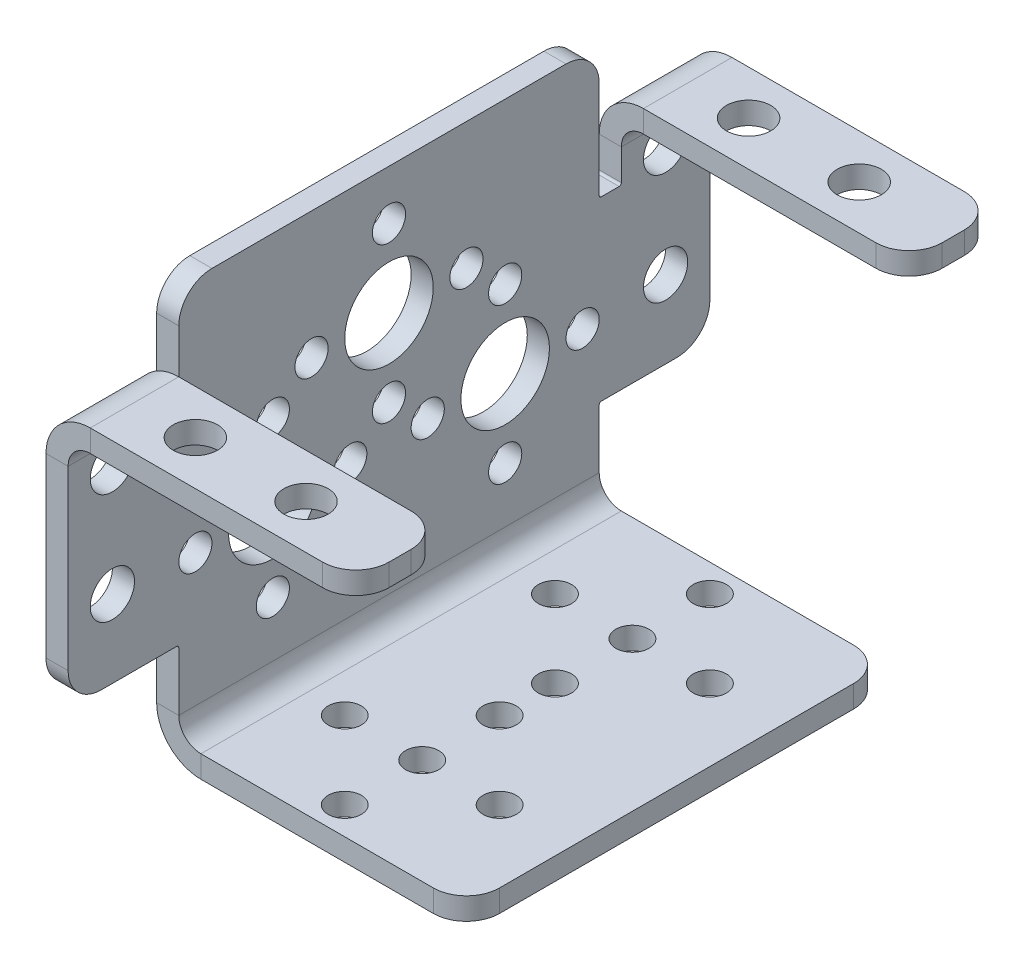
from build123d import *

# Parameters (mm, degrees)
BOSS_EXTRUDE1_DEPTH            = 1
CONVERT_SOLID1_START           = -1
CONVERT_SOLID1_DEPTH           = 1
EDGE_FLANGE1_STRIP_W           = 12
EDGE_FLANGE1_STRIP_H           = 2
EDGE_FLANGE1_STRIP_CUT_DEPTH   = 38
EDGE_FLANGE1_DEPTH             = 38
EDGE_FLANGE2_STRIP_W           = 12
EDGE_FLANGE2_STRIP_H           = 2
EDGE_FLANGE2_STRIP_CUT_DEPTH   = 8
EDGE_FLANGE2_STRIP_2_W         = 12
EDGE_FLANGE2_STRIP_2_H         = 2
EDGE_FLANGE2_STRIP_CUT_2_DEPTH = 8
EDGE_FLANGE2_DEPTH             = 8
EDGE_FLANGE2_BEND_DEPTH        = 8
FILLET1_R                      = 3
M3X0_5_TAPPED_HOLE1_D          = 3
SKETCH20_R                     = 4
CUT_EXTRUDE1_DEPTH             = 44.667665669
M4X0_7_TAPPED_HOLE1_D          = 4
M4X0_7_TAPPED_HOLE2_D          = 4
M3X0_5_TAPPED_HOLE2_D          = 3
FILLET2_R                      = 0.2


# Read off the part's stored shape, not the designer's step: Convert-Solid1
# Sheet-metal steps are written as plain solids
with BuildPart() as part:
    # Sketch1 → Boss-Extrude1 (new body)
    with BuildSketch(Plane(origin=(0, 0, 0), x_dir=(0, 0, -1), z_dir=(1, 0, 0))):
        with BuildLine():
            Line((-19, -17.745), (19, -17.745))
            Line((19, -17.745), (19, -10.245))
            Line((19, -10.245), (26, -10.245))
            ThreePointArc((26, -10.245), (28.121320344, -9.366320344), (29, -7.245))
            Line((29, -7.245), (29, 10.755))
            Line((29, 10.755), (21, 10.755))
            Line((21, 10.755), (21, 5.755))
            Line((21, 5.755), (19, 5.755))
            Line((19, 5.755), (19, 14.745))
            ThreePointArc((19, 14.745), (18.121320344, 16.866320344), (16, 17.745))
            Line((16, 17.745), (-16, 17.745))
            ThreePointArc((-16, 17.745), (-18.121320344, 16.866320344), (-19, 14.745))
            Line((-19, 14.745), (-19, 5.755))
            Line((-19, 5.755), (-21, 5.755))
            Line((-21, 5.755), (-21, 10.755))
            Line((-21, 10.755), (-29, 10.755))
            Line((-29, 10.755), (-29, -7.245))
            ThreePointArc((-29, -7.245), (-28.121320344, -9.366320344), (-26, -10.245))
            Line((-26, -10.245), (-19, -10.245))
            Line((-19, -10.245), (-19, -17.745))
        make_face()
    extrude(amount=BOSS_EXTRUDE1_DEPTH)

    # Convert-Solid1 outline → Convert-Solid1 (add)
    with BuildSketch(Plane.YZ.offset(CONVERT_SOLID1_START)):
        with BuildLine():
            Line((17.745, -16), (17.745, 16))
            ThreePointArc((17.745, 16), (16.866320344, 18.121320344), (14.745, 19))
            Line((14.745, 19), (5.755, 19))
            Line((5.755, 19), (5.755, 21))
            Line((5.755, 21), (10.755, 21))
            Line((10.755, 21), (10.755, 29))
            Line((10.755, 29), (-7.245, 29))
            ThreePointArc((-7.245, 29), (-9.366320344, 28.121320344), (-10.245, 26))
            Line((-10.245, 26), (-10.245, 19))
            Line((-10.245, 19), (-17.745, 19))
            Line((-17.745, 19), (-17.745, -19))
            Line((-17.745, -19), (-10.245, -19))
            Line((-10.245, -19), (-10.245, -26))
            ThreePointArc((-10.245, -26), (-9.366320344, -28.121320344), (-7.245, -29))
            Line((-7.245, -29), (10.755, -29))
            Line((10.755, -29), (10.755, -21))
            Line((10.755, -21), (5.755, -21))
            Line((5.755, -21), (5.755, -19))
            Line((5.755, -19), (14.745, -19))
            ThreePointArc((14.745, -19), (16.866320344, -18.121320344), (17.745, -16))
        make_face()
    extrude(amount=CONVERT_SOLID1_DEPTH)

    # Edge-Flange1 strip (across the edge) → Edge-Flange1 strip cut (cut)
    with BuildSketch(Plane(origin=(1, -17.745, 19), x_dir=(0, 1, 0), z_dir=(0, 0, -1))):
        with Locations((-4, -1)):
            Rectangle(EDGE_FLANGE1_STRIP_W, EDGE_FLANGE1_STRIP_H)
    extrude(amount=EDGE_FLANGE1_STRIP_CUT_DEPTH, mode=Mode.SUBTRACT)

    # Edge-Flange1 section (across the edge) → Edge-Flange1 (add)
    with BuildSketch(Plane(origin=(1, -17.745, 19), x_dir=(0, 1, 0), z_dir=(0, 0, -1))):
        with BuildLine():
            Line((-2, 2), (-2, 26))
            Line((-2, 26), (0, 26))
            Line((0, 26), (0, 2))
            ThreePointArc((0, 2), (0.585786438, 0.585786438), (2, 0))
            Line((2, 0), (2, -2))
            ThreePointArc((2, -2), (-0.828427125, -0.828427125), (-2, 2))
        make_face()
    extrude(amount=EDGE_FLANGE1_DEPTH)

    # Edge-Flange2 strip (across the edge) → Edge-Flange2 strip cut (cut)
    with BuildSketch(Plane(origin=(1, 10.755, 21), x_dir=(0, -1, 0), z_dir=(0, 0, 1))):
        with Locations((-4, -1)):
            Rectangle(EDGE_FLANGE2_STRIP_W, EDGE_FLANGE2_STRIP_H)
    extrude(amount=EDGE_FLANGE2_STRIP_CUT_DEPTH, mode=Mode.SUBTRACT)

    # Edge-Flange2 strip 2 (across the edge) → Edge-Flange2 strip cut 2 (cut)
    with BuildSketch(Plane(origin=(1, 10.755, -29), x_dir=(0, -1, 0), z_dir=(0, 0, 1))):
        with Locations((-4, -1)):
            Rectangle(EDGE_FLANGE2_STRIP_2_W, EDGE_FLANGE2_STRIP_2_H)
    extrude(amount=EDGE_FLANGE2_STRIP_CUT_2_DEPTH, mode=Mode.SUBTRACT)

    # Edge-Flange2 section (across the edge) → Edge-Flange2 (add)
    with BuildSketch(Plane(origin=(1, 10.755, 21), x_dir=(0, -1, 0), z_dir=(0, 0, 1))):
        with BuildLine():
            Line((-2, 2), (-2, 26))
            Line((-2, 26), (0, 26))
            Line((0, 26), (0, 2))
            ThreePointArc((0, 2), (0.585786438, 0.585786438), (2, 0))
            Line((2, 0), (2, -2))
            ThreePointArc((2, -2), (-0.828427125, -0.828427125), (-2, 2))
        make_face()
    extrude(amount=EDGE_FLANGE2_DEPTH)

    # Edge-Flange2 section 2 (across the edge) → Edge-Flange2 bend (add)
    with BuildSketch(Plane(origin=(1, 10.755, -29), x_dir=(0, -1, 0), z_dir=(0, 0, 1))):
        with BuildLine():
            Line((-2, 2), (-2, 26))
            Line((-2, 26), (0, 26))
            Line((0, 26), (0, 2))
            ThreePointArc((0, 2), (0.585786438, 0.585786438), (2, 0))
            Line((2, 0), (2, -2))
            ThreePointArc((2, -2), (-0.828427125, -0.828427125), (-2, 2))
        make_face()
    extrude(amount=EDGE_FLANGE2_BEND_DEPTH)

    # Fillet1
    fillet1_edges = [part.edges().sort_by_distance(p)[0] for p in [
        (27, 11.755, 21),
        (27, 11.755, 29),
        (27, 11.755, -29),
        (27, 11.755, -21),
        (27, -18.745, 19),
        (27, -18.745, -19),
    ]]
    fillet(fillet1_edges, radius=FILLET1_R)

    # M3x0.5 Tapped Hole1 (through all)
    with Locations(Plane(origin=(0, -19.745, 0), x_dir=(-1, 0, 0), z_dir=(0, -1, 0))):
        with Locations((-20.5, -9.5), (-6.5, -9.5), (-13.5, -9.5), (-13.5, -2.5), (-13.5, -16.5), (-6.5, 9.5), (-13.5, 2.5), (-20.5, 9.5), (-13.5, 9.5), (-13.5, 16.5)):
            Hole(M3X0_5_TAPPED_HOLE1_D / 2)

    # Sketch20 → Cut-Extrude1 (cut, through all)
    with BuildSketch(Plane(origin=(1, 0, 0), x_dir=(0, 0, -1), z_dir=(1, 0, 0))):
        with Locations((10.5, -3.745)):
            Circle(SKETCH20_R)
        with Locations((0, 6.255)):
            Circle(SKETCH20_R)
        with Locations((-10.5, -3.745)):
            Circle(SKETCH20_R)
    extrude(amount=-CUT_EXTRUDE1_DEPTH, mode=Mode.SUBTRACT)

    # M4x0.7 Tapped Hole1 (through all)
    with Locations(Plane(origin=(0, 10.755, 0), x_dir=(-1, 0, 0), z_dir=(0, -1, 0))):
        with Locations((-18.5, -25), (-8.5, -25), (-8.5, 25), (-18.5, 25)):
            Hole(M4X0_7_TAPPED_HOLE1_D / 2)

    # M4x0.7 Tapped Hole2 (through all)
    with Locations(Plane(origin=(1, 0, 0), x_dir=(0, 0, -1), z_dir=(1, 0, 0))):
        with Locations((25, -3.245), (25, 6.755), (-25, 6.755), (-25, -3.245)):
            Hole(M4X0_7_TAPPED_HOLE2_D / 2)

    # M3x0.5 Tapped Hole2 (through all)
    with Locations(Plane(origin=(1, 0, 0), x_dir=(0, 0, -1), z_dir=(1, 0, 0))):
        with Locations((-10.5, 3.255), (-10.5, -10.745), (-3.5, -3.745), (-17.5, -3.745), (0, 13.255), (0, -0.745), (7, 6.255), (-7, 6.255), (10.5, 3.255), (10.5, -10.745), (17.5, -3.745), (3.5, -3.745)):
            Hole(M3X0_5_TAPPED_HOLE2_D / 2)

    # Fillet2
    fillet2_edges = [part.edges().sort_by_distance(p)[0] for p in [
        (0, 5.755, -19),
        (0, 5.755, -21),
        (0, -10.245, -19),
        (0, -10.245, 19),
        (0, 5.755, 21),
        (0, 5.755, 19),
    ]]
    fillet(fillet2_edges, radius=FILLET2_R)


solid = part.part
